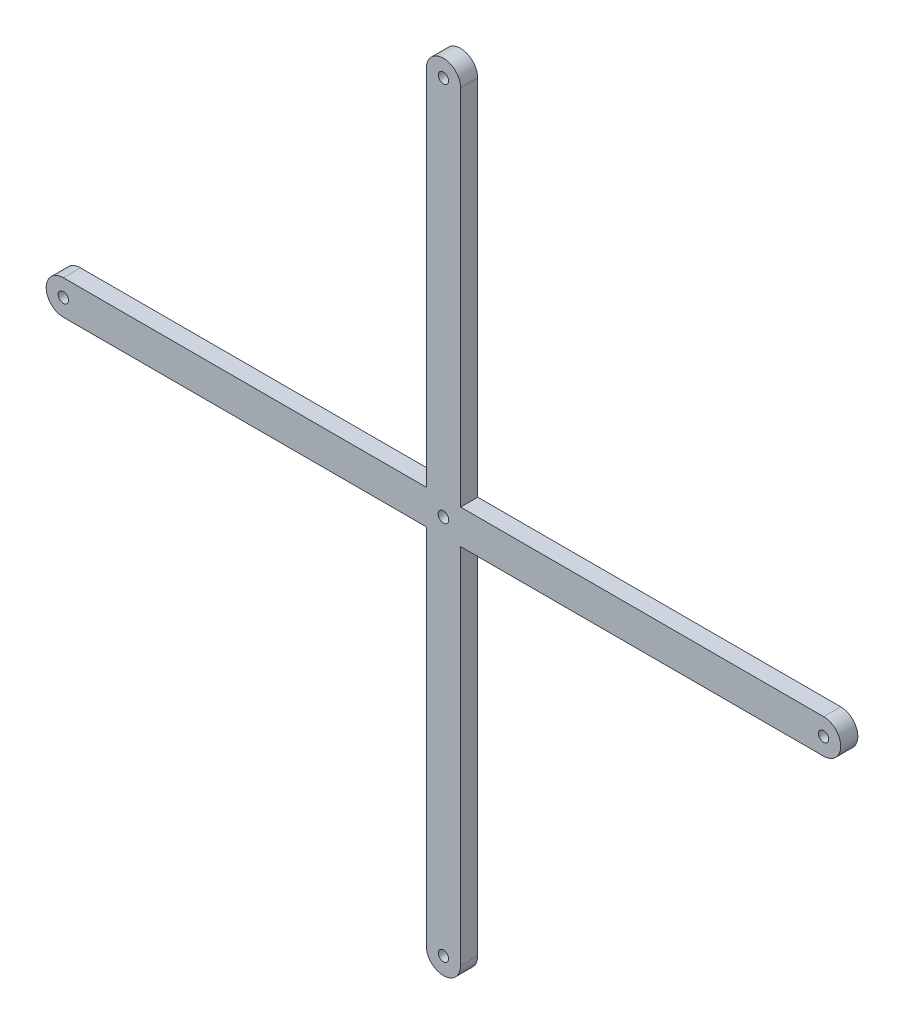
from build123d import *

# Parameters (mm, degrees)
SKETCH1_R           = 1.55
SKETCH1_R_2         = 1.5
BOSS_EXTRUDE1_DEPTH = 5


with BuildPart() as part:
    # Sketch1 → Boss-Extrude1 (new body)
    with BuildSketch(Plane.XY):
        with BuildLine():
            Line((5, -5), (5, -111))
            ThreePointArc((5, -111), (0, -116), (-5, -111))
            Line((-5, -111), (-5, -5))
            Line((-5, -5), (-111, -5))
            ThreePointArc((-111, -5), (-116, 0), (-111, 5))
            Line((-111, 5), (-5, 5))
            Line((-5, 5), (-5, 111))
            ThreePointArc((-5, 111), (0, 116), (5, 111))
            Line((5, 111), (5, 5))
            Line((5, 5), (111, 5))
            ThreePointArc((111, 5), (116, 0), (111, -5))
            Line((111, -5), (5, -5))
        make_face()
        Circle(SKETCH1_R, mode=Mode.SUBTRACT)
        with Locations((0, -111)):
            Circle(SKETCH1_R_2, mode=Mode.SUBTRACT)
        with Locations((-111, 0)):
            Circle(SKETCH1_R_2, mode=Mode.SUBTRACT)
        with Locations((0, 111)):
            Circle(SKETCH1_R_2, mode=Mode.SUBTRACT)
        with Locations((111, 0)):
            Circle(SKETCH1_R_2, mode=Mode.SUBTRACT)
    extrude(amount=BOSS_EXTRUDE1_DEPTH)


solid = part.part
